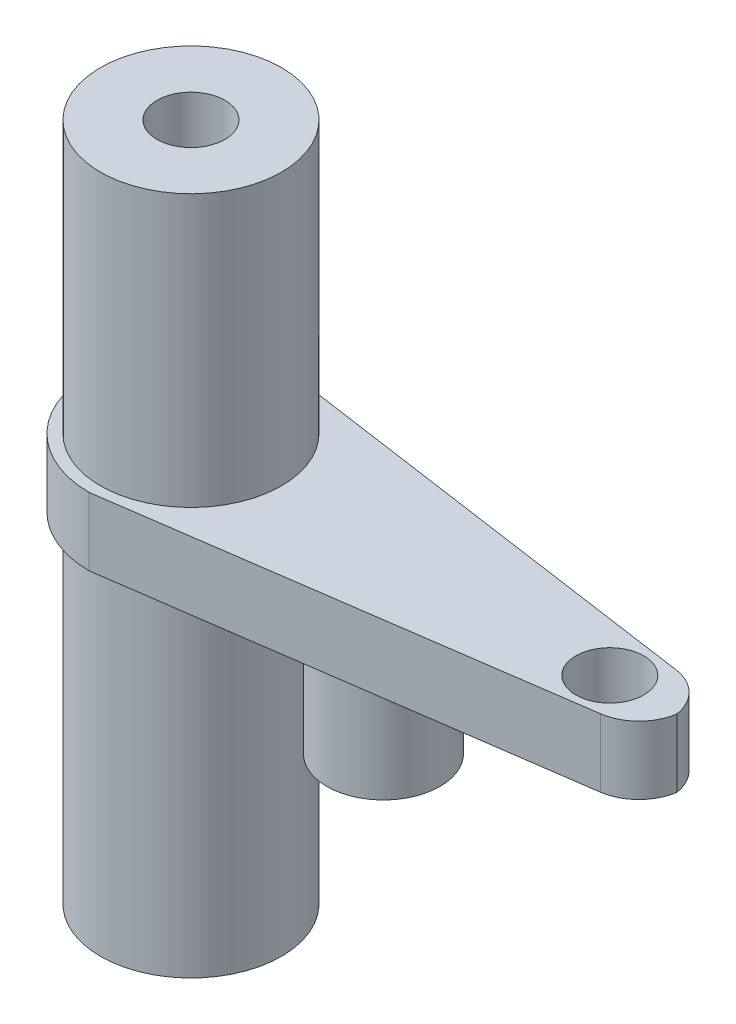
from build123d import *

# Parameters (mm, degrees)
SKETCH1_R           = 4
BOSS_EXTRUDE1_DEPTH = 15
SKETCH2_R           = 1.5
BOSS_EXTRUDE4_DEPTH = 3
FILLET4_R           = 2
SKETCH7_R           = 4
BOSS_EXTRUDE5_DEPTH = 13
SKETCH8_R           = 1.5
CUT_EXTRUDE6_DEPTH  = 10
SKETCH10_R          = 1.25
CUT_EXTRUDE7_DEPTH  = 10
SKETCH11_R          = 2.5
BOSS_EXTRUDE6_DEPTH = 5
SKETCH12_R          = 1.25
CUT_EXTRUDE8_DEPTH  = 5
CUT_EXTRUDE10_START = -1
SKETCH14_R          = 4
CUT_EXTRUDE10_DEPTH = 1


with BuildPart() as part:
    # Sketch1 → Boss-Extrude1 (new body)
    with BuildSketch(Plane(origin=(0, 0, 0), x_dir=(1, 0, 0), z_dir=(0, 1, 0))):
        with Locations(Location((0, 0, 0), (0, 0, 270))):
            Circle(SKETCH1_R)
    extrude(amount=BOSS_EXTRUDE1_DEPTH)

    # Sketch2 → Boss-Extrude4 (add)
    with BuildSketch(Plane(origin=(0, 15, 0), x_dir=(1, 0, 0), z_dir=(0, 1, 0))):
        with BuildLine():
            Line((21.256644483, 1.459786884), (0, 4.5))
            ThreePointArc((0, 4.5), (-4.5, 0), (0, -4.5))
            Line((0, -4.5), (21.256644483, -1.459786884))
            ThreePointArc((21.256644483, -1.459786884), (21.5, 0), (21.256644483, 1.459786884))
        make_face()
        with Locations(Location((18.5, 0, 0), (0, 0, 270))):
            Circle(SKETCH2_R, mode=Mode.SUBTRACT)
    extrude(amount=BOSS_EXTRUDE4_DEPTH)

    # Fillet4
    # the kernel refuses this fillet: 2 mm, written as the material it takes off along each edge
    with BuildSketch(Plane(origin=(21.256644483, 9.943560337, -1.459786884), x_dir=(0.10352186513244716, 0, 0.9946271781122308), z_dir=(0, 1, 0))) as fillet4_piece_1:
        with BuildLine():
            CenterArc((1.573114562, -1.948841845), FILLET4_R, 77.012959975, 88.905549933)
            Line((-0.366786771, -1.462238498), (0, 0))
            ThreePointArc((0, 0), (1.011287933, 0.115105849), (2.022575865, 0))
        make_face()
    extrude(amount=13.112879326, mode=Mode.SUBTRACT)
    with BuildSketch(Plane(origin=(21.256644483, 9.943560337, 1.459786884), x_dir=(-0.9899263374983104, 0, 0.14158335469673372), z_dir=(0, 1, 0))) as fillet4_piece_2:
        with BuildLine():
            CenterArc((1.507539041, -2), FILLET4_R, 90, 88.905549933)
            ThreePointArc((-0.492096093, -1.961798809), (-0.357695041, -0.952893959), (0, 0))
            Line((0, 0), (1.507539041, 0))
        make_face()
    extrude(amount=13.112879326, mode=Mode.SUBTRACT)

    # Sketch7 → Boss-Extrude5 (add)
    with BuildSketch(Plane(origin=(0, 18, 0), x_dir=(1, 0, 0), z_dir=(0, 1, 0))):
        with Locations(Location((0, 0, 0), (0, 0, 270))):
            Circle(SKETCH7_R)
    extrude(amount=BOSS_EXTRUDE5_DEPTH)

    # Sketch8 → Cut-Extrude6 (cut)
    with BuildSketch(Plane(origin=(0, 31, 0), x_dir=(1, 0, 0), z_dir=(0, 1, 0))):
        with Locations(Location((0, 0, 0), (0, 0, 270))):
            Circle(SKETCH8_R)
    extrude(amount=-CUT_EXTRUDE6_DEPTH, mode=Mode.SUBTRACT)

    # Sketch10 → Cut-Extrude7 (cut)
    with BuildSketch(Plane.XZ):
        with Locations(Location((0, 0, 0), (0, 0, 270))):
            Circle(SKETCH10_R)
    extrude(amount=-CUT_EXTRUDE7_DEPTH, mode=Mode.SUBTRACT)

    # Sketch11 → Boss-Extrude6 (add)
    with BuildSketch(Plane.XZ.offset(-15)):
        with Locations(Location((8.5, 0, 0), (0, 0, 90))):
            Circle(SKETCH11_R)
    extrude(amount=BOSS_EXTRUDE6_DEPTH)

    # Sketch12 → Cut-Extrude8 (cut)
    with BuildSketch(Plane.XZ.offset(-10)):
        with Locations(Location((8.5, 0, 0), (0, 0, 270))):
            Circle(SKETCH12_R)
    extrude(amount=-CUT_EXTRUDE8_DEPTH, mode=Mode.SUBTRACT)

    # Sketch14 → Cut-Extrude10 (cut)
    with BuildSketch(Plane(origin=(0, 31, 0), x_dir=(1, 0, 0), z_dir=(0, 1, 0)).offset(CUT_EXTRUDE10_START)):
        with Locations(Location((0, 0, 0), (0, 0, 90))):
            Circle(SKETCH14_R)
    extrude(amount=CUT_EXTRUDE10_DEPTH, mode=Mode.SUBTRACT)


solid = part.part
